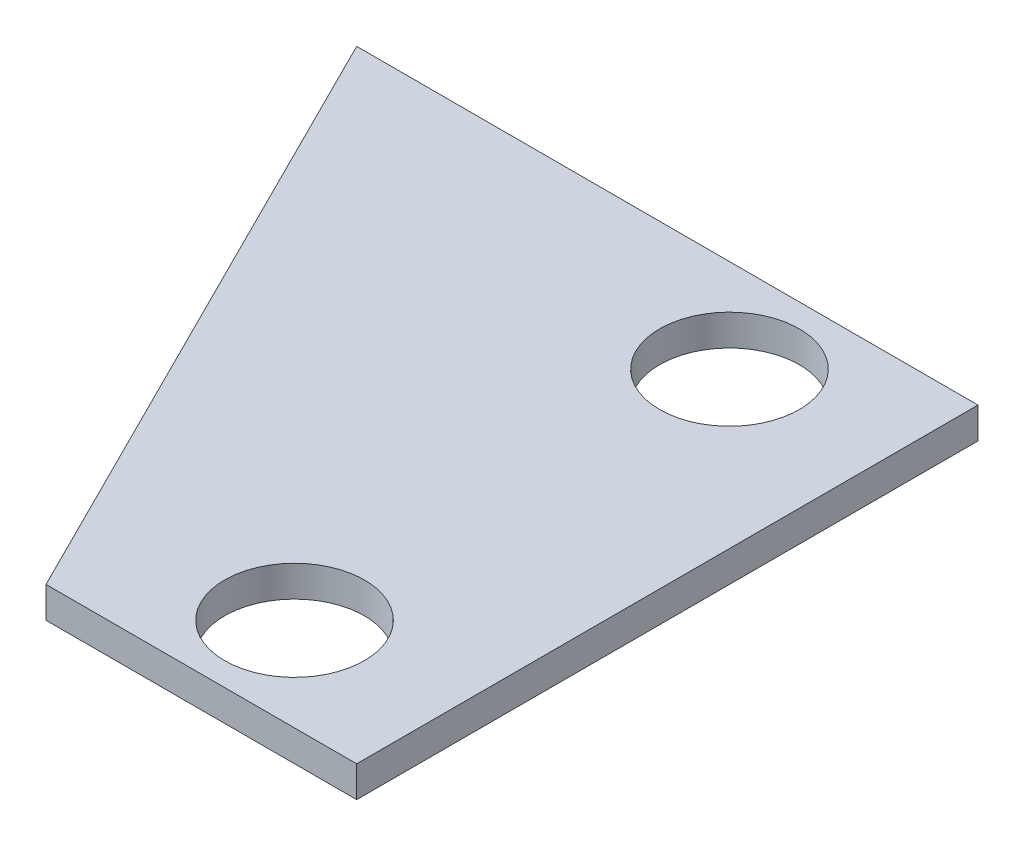
from build123d import *

# Parameters (mm, degrees)
SKETCH1_R           = 2.25
BOSS_EXTRUDE1_DEPTH = 1


with BuildPart() as part:
    # Sketch1 → Boss-Extrude1 (new body)
    with BuildSketch(Plane(origin=(0, 0, 0), x_dir=(1, 0, 0), z_dir=(0, 1, 0))):
        Polygon((-5, -10), (-15, 10), (-5, 10), (5, 10), (5, -10), align=None)
        with Locations((0, 7)):
            Circle(SKETCH1_R, mode=Mode.SUBTRACT)
        with Locations((0, -7)):
            Circle(SKETCH1_R, mode=Mode.SUBTRACT)
    extrude(amount=BOSS_EXTRUDE1_DEPTH)


solid = part.part
